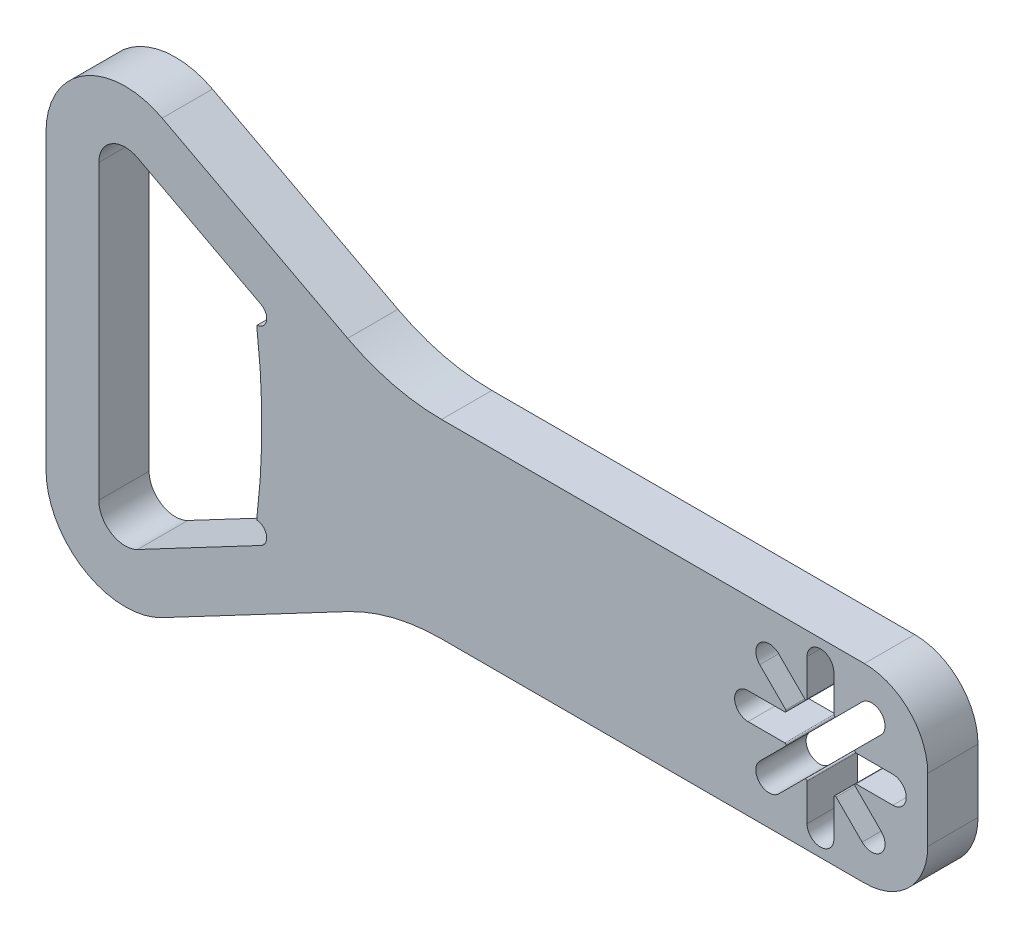
from build123d import *

# Parameters (mm, degrees)
BOSS_EXTRUDE1_DEPTH = 4.7625
CUT_EXTRUDE1_DEPTH  = 296.22228981
FILLET1_R           = 0.127


with BuildPart() as part:
    # Model → Boss-Extrude1 (new body)
    with BuildSketch(Plane.XY):
        with BuildLine():
            Line((93.450952687, 245.03072761), (75.889188638, 254.308203871))
            ThreePointArc((75.889188638, 254.308203871), (68.514514164, 254.100258783), (64.885909847, 247.676685364))
            Line((64.885909847, 247.676685364), (64.885909847, 219.972883873))
            ThreePointArc((64.885909847, 219.972883873), (68.514514164, 213.549310454), (75.889188638, 213.341365366))
            Line((75.889188638, 213.341365366), (93.450952687, 222.618841627))
            ThreePointArc((93.450952687, 222.618841627), (97.765438869, 224.265076477), (102.349280816, 224.824784618))
            Line((102.349280816, 224.824784618), (142.385909847, 224.824784618))
            ThreePointArc((142.385909847, 224.824784618), (146.628550534, 226.582143931), (148.385909847, 230.824784618))
            Line((148.385909847, 230.824784618), (148.385909847, 236.824784618))
            ThreePointArc((148.385909847, 236.824784618), (146.628550534, 241.067425306), (142.385909847, 242.824784618))
            Line((142.385909847, 242.824784618), (102.349280816, 242.824784618))
            ThreePointArc((102.349280816, 242.824784618), (97.765438869, 243.38449276), (93.450952687, 245.03072761))
        make_face()
        with BuildLine():
            Line((73.553669444, 217.762377704), (85.257358528, 223.945167619))
            ThreePointArc((85.257358528, 223.945167619), (85.71629755, 224.451951724), (85.742353062, 225.135161989))
            ThreePointArc((85.742353062, 225.135161989), (85.41742429, 225.608252807), (84.885909847, 225.824784618))
            Line((84.885909847, 225.824784618), (84.885909847, 226.324784618))
            ThreePointArc((84.885909847, 226.324784618), (85.330378765, 233.824784618), (84.885909847, 241.324784618))
            Line((84.885909847, 241.324784618), (84.885909847, 241.824784618))
            ThreePointArc((84.885909847, 241.824784618), (85.41742429, 242.04131643), (85.742353062, 242.514407247))
            ThreePointArc((85.742353062, 242.514407247), (85.71629755, 243.197617512), (85.257358528, 243.704401618))
            Line((85.257358528, 243.704401618), (73.553669444, 249.887191533))
            ThreePointArc((73.553669444, 249.887191533), (71.095444619, 249.817876503), (69.885909847, 247.676685364))
            Line((69.885909847, 247.676685364), (69.885909847, 219.972883873))
            ThreePointArc((69.885909847, 219.972883873), (71.095444619, 217.831692734), (73.553669444, 217.762377704))
        make_face(mode=Mode.SUBTRACT)
    extrude(amount=BOSS_EXTRUDE1_DEPTH)

    # Sketch2 → Cut-Extrude1 (cut, through all)
    with BuildSketch(Plane.XY.offset(4.7625)):
        with BuildLine():
            Line((136.955909847, 226.966784618), (136.955909847, 230.758733394))
            Line((136.955909847, 230.758733394), (134.274597154, 228.077420701))
            ThreePointArc((134.274597154, 228.077420701), (132.478545929, 228.077420701), (132.478545929, 229.873471925))
            Line((132.478545929, 229.873471925), (135.159858623, 232.554784618))
            Line((135.159858623, 232.554784618), (131.367909847, 232.554784618))
            ThreePointArc((131.367909847, 232.554784618), (130.097909847, 233.824784618), (131.367909847, 235.094784618))
            Line((131.367909847, 235.094784618), (135.159858623, 235.094784618))
            Line((135.159858623, 235.094784618), (132.478545929, 237.776097312))
            ThreePointArc((132.478545929, 237.776097312), (132.478545929, 239.572148536), (134.274597154, 239.572148536))
            Line((134.274597154, 239.572148536), (136.955909847, 236.890835843))
            Line((136.955909847, 236.890835843), (136.955909847, 240.682784618))
            ThreePointArc((136.955909847, 240.682784618), (138.225909847, 241.952784618), (139.495909847, 240.682784618))
            Line((139.495909847, 240.682784618), (139.495909847, 236.890835843))
            Line((139.495909847, 236.890835843), (142.17722254, 239.572148536))
            ThreePointArc((142.17722254, 239.572148536), (143.973273764, 239.572148536), (143.973273764, 237.776097312))
            Line((143.973273764, 237.776097312), (141.291961071, 235.094784618))
            Line((141.291961071, 235.094784618), (145.083909847, 235.094784618))
            ThreePointArc((145.083909847, 235.094784618), (146.353909847, 233.824784618), (145.083909847, 232.554784618))
            Line((145.083909847, 232.554784618), (141.291961071, 232.554784618))
            Line((141.291961071, 232.554784618), (143.973273764, 229.873471925))
            ThreePointArc((143.973273764, 229.873471925), (143.973273764, 228.077420701), (142.17722254, 228.077420701))
            Line((142.17722254, 228.077420701), (139.495909847, 230.758733394))
            Line((139.495909847, 230.758733394), (139.495909847, 226.966784618))
            ThreePointArc((139.495909847, 226.966784618), (138.225909847, 225.696784618), (136.955909847, 226.966784618))
        make_face()
    extrude(amount=-CUT_EXTRUDE1_DEPTH, mode=Mode.SUBTRACT)

    # Fillet1
    fillet1_edges = [part.edges().sort_by_distance(p)[0] for p in [
        (136.955909847, 230.758733394, 2.38125),
        (139.495909847, 230.758733394, 2.38125),
        (141.291961071, 235.094784618, 2.38125),
        (141.291961071, 232.554784618, 2.38125),
        (135.159858623, 232.554784618, 2.38125),
        (135.159858623, 235.094784618, 2.38125),
        (136.955909847, 236.890835843, 2.38125),
        (139.495909847, 236.890835843, 2.38125),
    ]]
    fillet(fillet1_edges, radius=FILLET1_R)


solid = part.part
